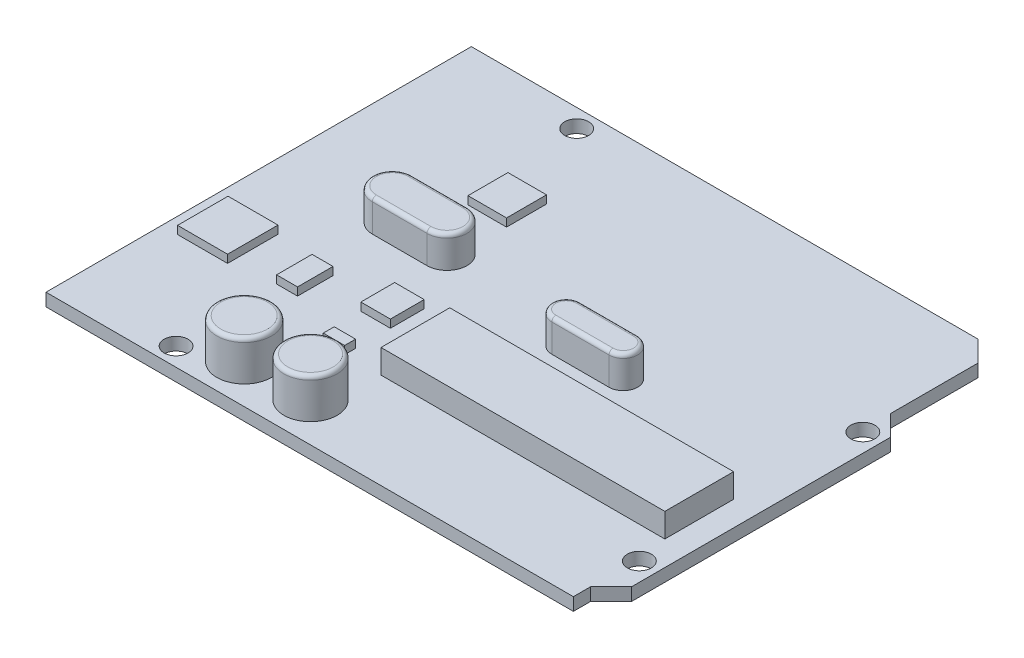
from build123d import *

# Parameters (mm, degrees)
SALIENTE_EXTRUIR1_DEPTH = 1.6
CHAFL_N1_SIZE           = 2.6
CROQUIS2_R              = 1.5
CORTAR_EXTRUIR1_DEPTH   = 87.926822673
CROQUIS3_W              = 35.565034919
CROQUIS3_H              = 8.613377017
SALIENTE_EXTRUIR2_DEPTH = 3
CROQUIS4_R              = 3.336672647
CROQUIS4_R_2            = 3.426556793
SALIENTE_EXTRUIR3_DEPTH = 5
CROQUIS5_W              = 6.263410385
CROQUIS5_H              = 6.323061912
CROQUIS5_W_2            = 3.698394703
CROQUIS5_H_2            = 4.23525845
CROQUIS5_W_3            = 2.624667209
CROQUIS5_H_3            = 4.444038797
CROQUIS5_W_4            = 2.684318736
CROQUIS5_H_4            = 1.371985132
CROQUIS5_W_5            = 4.831773725
CROQUIS5_H_5            = 5.010728307
SALIENTE_EXTRUIR4_DEPTH = 1
SALIENTE_EXTRUIR5_DEPTH = 4
REDONDEO1_R             = 0.5


with BuildPart() as part:
    # Croquis1 → Saliente-Extruir1 (new body)
    with BuildSketch(Plane(origin=(0, 0, 0), x_dir=(1, 0, 0), z_dir=(0, 1, 0))):
        Polygon((0, 53.3), (66.08, 53.3), (66.08, 39.738845798), (68.65, 39.738845798), (68.65, 2.138845798), (66.08, 2.138845798), (66.08, 0), (0, 0), align=None)
    extrude(amount=SALIENTE_EXTRUIR1_DEPTH)

    # Chaflán1
    # the kernel refuses this chamfer: 2.6 mm, written as the material it takes off along each edge
    with BuildSketch(Plane(origin=(68.65, -6.686375769, -39.738845798), x_dir=(-0.9996219169112966, 0, -0.027495876610585446), z_dir=(0, 1, 0))) as chafl_n1_piece_1_section:
        Polygon((CHAFL_N1_SIZE * 0.999621916911, CHAFL_N1_SIZE * 0.0274958766106), (-CHAFL_N1_SIZE * 0.0274958766106, CHAFL_N1_SIZE * 0.999621916911), (0, 0), align=None)
    chafl_n1_piece_1 = extrude(amount=14.972751537, mode=Mode.PRIVATE)
    chafl_n1_piece_1 = split(chafl_n1_piece_1, bisect_by=Plane(origin=(66.08, 0.8, -38.878812764), z_dir=(1, 0, 0)), keep=Keep.TOP, mode=Mode.PRIVATE)
    add(chafl_n1_piece_1, mode=Mode.SUBTRACT)
    with BuildSketch(Plane(origin=(68.65, -6.686375769, -2.138845798), x_dir=(0.027495876610585345, 0, -0.9996219169112966), z_dir=(0, 1, 0))) as chafl_n1_piece_2_section:
        Polygon((CHAFL_N1_SIZE * 0.999621916911, CHAFL_N1_SIZE * 0.0274958766106), (-CHAFL_N1_SIZE * 0.0274958766106, CHAFL_N1_SIZE * 0.999621916911), (0, 0), align=None)
    chafl_n1_piece_2 = extrude(amount=14.972751537, mode=Mode.PRIVATE)
    chafl_n1_piece_2 = split(chafl_n1_piece_2, bisect_by=Plane(origin=(66.08, 0.8, -2.998878832), z_dir=(1, 0, 0)), keep=Keep.TOP, mode=Mode.PRIVATE)
    add(chafl_n1_piece_2, mode=Mode.SUBTRACT)
    with BuildSketch(Plane(origin=(66.08, -6.686375769, -53.3), x_dir=(-0.9996219169112966, 0, -0.027495876610585373), z_dir=(0, 1, 0))) as chafl_n1_piece_3:
        Polygon((CHAFL_N1_SIZE * 0.999621916911, CHAFL_N1_SIZE * 0.0274958766106), (-CHAFL_N1_SIZE * 0.0274958766106, CHAFL_N1_SIZE * 0.999621916911), (0, 0), align=None)
    extrude(amount=14.972751537, mode=Mode.SUBTRACT)

    # Croquis2 → Cortar-Extruir1 (cut, through all)
    with BuildSketch(Plane(origin=(0, 1.6, 0), x_dir=(1, 0, 0), z_dir=(0, 1, 0))):
        with Locations(Location((15.5, 51, 0), (0, 0, 270))):
            Circle(CROQUIS2_R)
        with Locations(Location((66.35, 36, 0), (0, 0, 270))):
            Circle(CROQUIS2_R)
        with Locations(Location((66.35, 8, 0), (0, 0, 270))):
            Circle(CROQUIS2_R)
        with Locations(Location((14, 2.3, 0), (0, 0, 270))):
            Circle(CROQUIS2_R)
    extrude(amount=-CORTAR_EXTRUIR1_DEPTH, mode=Mode.SUBTRACT)

    # Croquis3 → Saliente-Extruir2 (add)
    with BuildSketch(Plane(origin=(0, 1.6, 0), x_dir=(1, 0, 0), z_dir=(0, 1, 0))):
        with Locations((47.771511194, 16.294435422)):
            Rectangle(CROQUIS3_W, CROQUIS3_H)
    extrude(amount=SALIENTE_EXTRUIR2_DEPTH)

    # Croquis4 → Saliente-Extruir3 (add)
    with BuildSketch(Plane(origin=(0, 1.6, 0), x_dir=(1, 0, 0), z_dir=(0, 1, 0))):
        with Locations(Location((28.27044436, 4.874550457, 0), (0, 0, 90))):
            Circle(CROQUIS4_R)
        with Locations(Location((19.960106187, 4.874550457, 0), (0, 0, 90))):
            Circle(CROQUIS4_R_2)
    extrude(amount=SALIENTE_EXTRUIR3_DEPTH)

    # Croquis5 → Saliente-Extruir4 (add)
    with BuildSketch(Plane(origin=(0, 1.6, 0), x_dir=(1, 0, 0), z_dir=(0, 1, 0))):
        with Locations((5.120871528, 17.658331847)):
            Rectangle(CROQUIS5_W, CROQUIS5_H)
        with Locations((23.642670808, 19.775961072)):
            Rectangle(CROQUIS5_W_2, CROQUIS5_H_2)
        with Locations((14.87389627, 17.553941673)):
            Rectangle(CROQUIS5_W_3, CROQUIS5_H_3)
        with Locations((24.149708791, 12.617777775)):
            Rectangle(CROQUIS5_W_4, CROQUIS5_H_4)
        with Locations((19.377586593, 38.417063407)):
            Rectangle(CROQUIS5_W_5, CROQUIS5_H_5)
    extrude(amount=SALIENTE_EXTRUIR4_DEPTH)

    # Croquis6 → Saliente-Extruir5 (add)
    with BuildSketch(Plane(origin=(0, 1.6, 0), x_dir=(1, 0, 0), z_dir=(0, 1, 0))):
        with BuildLine():
            Line((14.144691977, 31.757239244), (20.991330498, 31.757239244))
            ThreePointArc((20.991330498, 31.757239244), (23.496200875, 29.252368867), (20.991330498, 26.74749849))
            Line((20.991330498, 26.74749849), (14.144691977, 26.74749849))
            ThreePointArc((14.144691977, 26.74749849), (11.6398216, 29.252368867), (14.144691977, 31.757239244))
        make_face()
        with BuildLine():
            Line((38.431163378, 28.540921146), (45.590129983, 28.540921146))
            ThreePointArc((45.590129983, 28.540921146), (47.383552638, 26.74749849), (45.590129983, 24.954075835))
            Line((45.590129983, 24.954075835), (38.431163378, 24.954075835))
            ThreePointArc((38.431163378, 24.954075835), (36.637740722, 26.74749849), (38.431163378, 28.540921146))
        make_face()
    extrude(amount=SALIENTE_EXTRUIR5_DEPTH)

    # Redondeo1
    redondeo1_edges = [part.edges().sort_by_distance(p)[0] for p in [
        (11.6398216, 5.6, -29.252368867),
        (17.568011237, 5.6, -26.74749849),
        (23.496200875, 5.6, -29.252368867),
        (17.568011237, 5.6, -31.757239244),
        (36.637740722, 5.6, -26.74749849),
        (42.01064668, 5.6, -24.954075835),
        (47.383552638, 5.6, -26.74749849),
        (42.01064668, 5.6, -28.540921146),
        (28.27044436, 6.6, -1.53787781),
        (19.960106187, 6.6, -1.447993664),
    ]]
    fillet(redondeo1_edges, radius=REDONDEO1_R)


solid = part.part
